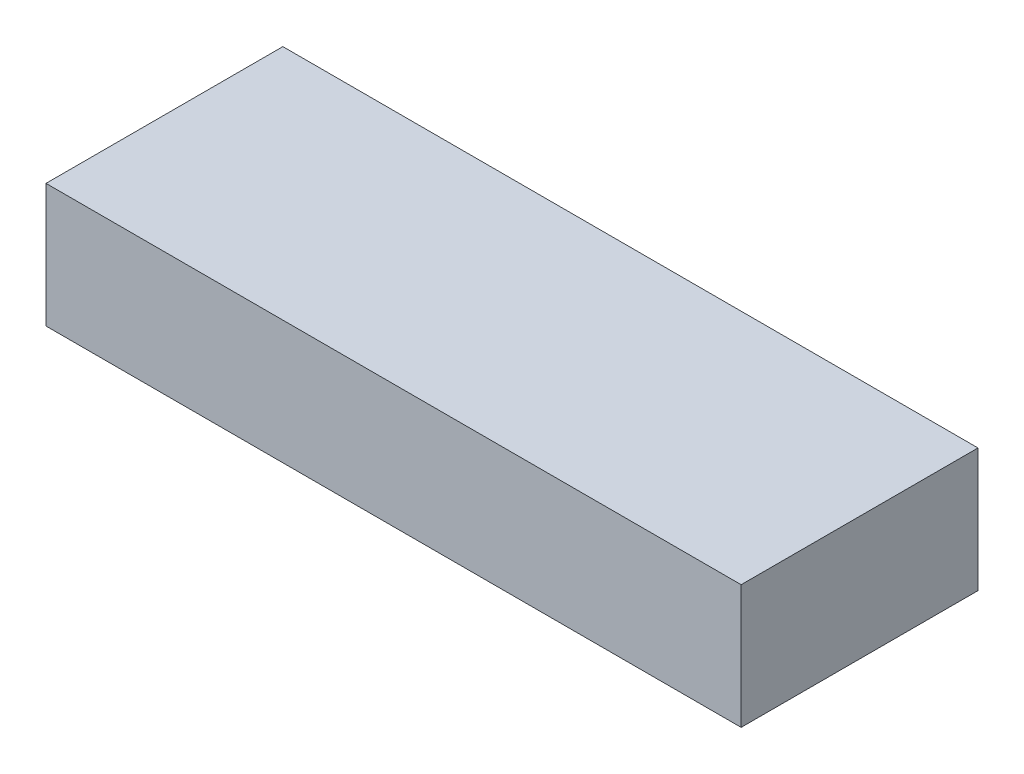
from build123d import *

# Parameters (mm, degrees)
SKETCH1_W           = 135
SKETCH1_H           = 46
BOSS_EXTRUDE1_DEPTH = 24


with BuildPart() as part:
    # Sketch1 → Boss-Extrude1 (new body)
    with BuildSketch(Plane(origin=(0, 0, 0), x_dir=(1, 0, 0), z_dir=(0, 1, 0))):
        Rectangle(SKETCH1_W, SKETCH1_H)
    extrude(amount=BOSS_EXTRUDE1_DEPTH)


solid = part.part
